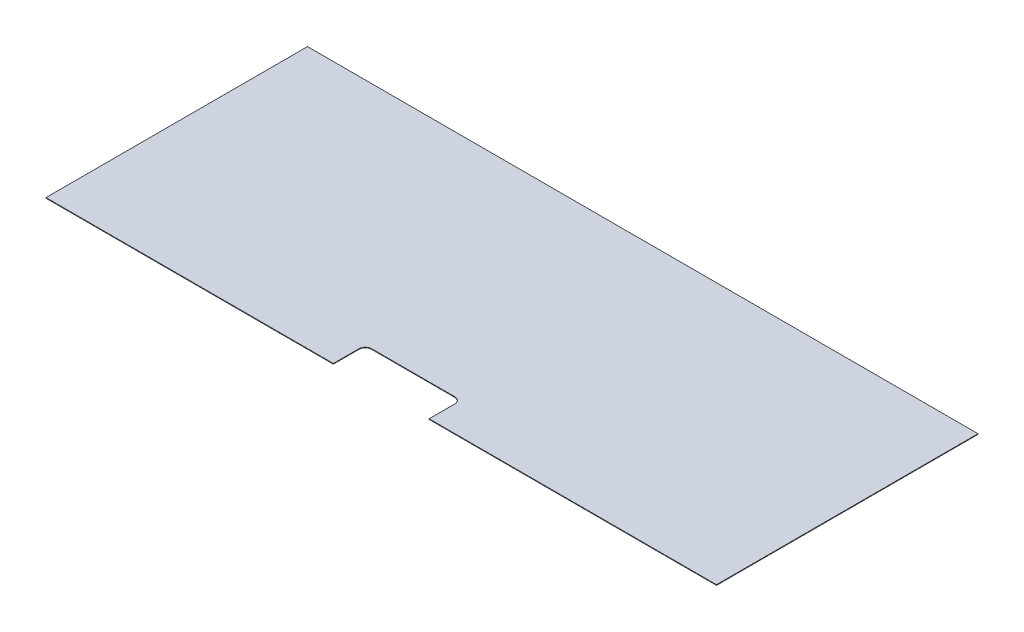
from build123d import *

# Parameters (mm, degrees)
SKETCH1_W           = 1050
SKETCH1_H           = 409.5
BOSS_EXTRUDE1_DEPTH = 1
SKETCH2_W           = 150
SKETCH2_H           = 50
CUT_EXTRUDE1_DEPTH  = 1
FILLET1_R           = 10


with BuildPart() as part:
    # Sketch1 → Boss-Extrude1 (new body)
    with BuildSketch(Plane(origin=(0, 0, 0), x_dir=(1, 0, 0), z_dir=(0, 1, 0))):
        with Locations((-18.909884175, 328.455718826)):
            Rectangle(SKETCH1_W, SKETCH1_H)
    extrude(amount=BOSS_EXTRUDE1_DEPTH)

    # Sketch2 → Cut-Extrude1 (cut)
    with BuildSketch(Plane(origin=(0, 1, 0), x_dir=(1, 0, 0), z_dir=(0, 1, 0))):
        with Locations((-18.909884175, 148.705718826)):
            Rectangle(SKETCH2_W, SKETCH2_H)
    extrude(amount=-CUT_EXTRUDE1_DEPTH, mode=Mode.SUBTRACT)

    # Fillet1
    fillet1_edges = [part.edges().sort_by_distance(p)[0] for p in [
        (56.090115825, 0.5, -173.705718826),
        (-93.909884175, 0.5, -173.705718826),
    ]]
    fillet(fillet1_edges, radius=FILLET1_R)


solid = part.part
